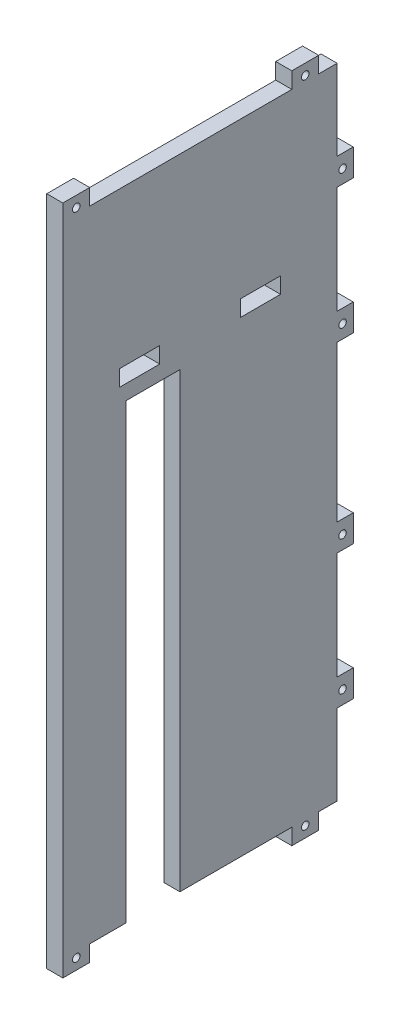
from build123d import *

# Parameters (mm, degrees)
ESQUISSE1_W             = 102.17
ESQUISSE1_H             = 238
ESQUISSE1_W_2           = 15
ESQUISSE1_H_2           = 6
BOSS_EXTRU_1_DEPTH      = 6
ESQUISSE3_W             = 10
ESQUISSE3_H             = 6
ESQUISSE3_W_2           = 6
ESQUISSE3_H_2           = 10
BOSS_EXTRU_5_DEPTH      = 6
ESQUISSE4_R             = 1.4
ENL_V_MAT_EXTRU_1_DEPTH = 6
ESQUISSE6_W             = 20
ESQUISSE6_H             = 168.46
ENL_V_MAT_EXTRU_2_DEPTH = 6


with BuildPart() as part:
    # Esquisse1 → Boss.-Extru.1 (new body)
    with BuildSketch(Plane(origin=(0, 0, 0), x_dir=(0, 0, -1), z_dir=(1, 0, 0))):
        Rectangle(ESQUISSE1_W, ESQUISSE1_H)
        with Locations((-22.5, 58)):
            Rectangle(ESQUISSE1_W_2, ESQUISSE1_H_2, mode=Mode.SUBTRACT)
        with Locations((22.5, 58)):
            Rectangle(ESQUISSE1_W_2, ESQUISSE1_H_2, mode=Mode.SUBTRACT)
    extrude(amount=BOSS_EXTRU_1_DEPTH)

    # Esquisse3 → Boss.-Extru.5 (add)
    with BuildSketch(Plane(origin=(6, 0, 0), x_dir=(0, 0, -1), z_dir=(1, 0, 0))):
        with Locations((-46.085, -122)):
            Rectangle(ESQUISSE3_W, ESQUISSE3_H)
        with Locations((39.205, -122)):
            Rectangle(ESQUISSE3_W, ESQUISSE3_H)
        with Locations((54.085, 84)):
            Rectangle(ESQUISSE3_W_2, ESQUISSE3_H_2)
        with Locations((54.085, 34)):
            Rectangle(ESQUISSE3_W_2, ESQUISSE3_H_2)
        with Locations((54.085, -34)):
            Rectangle(ESQUISSE3_W_2, ESQUISSE3_H_2)
        with Locations((54.085, -84)):
            Rectangle(ESQUISSE3_W_2, ESQUISSE3_H_2)
        with Locations((39.205, 122)):
            Rectangle(ESQUISSE3_W, ESQUISSE3_H)
        with Locations((-46.085, 122)):
            Rectangle(ESQUISSE3_W, ESQUISSE3_H)
    extrude(amount=-BOSS_EXTRU_5_DEPTH)

    # Esquisse4 → Enlèv. mat.-Extru.1 (cut)
    with BuildSketch(Plane(origin=(6, 0, 0), x_dir=(0, 0, -1), z_dir=(1, 0, 0))):
        with Locations((39.205, -121)):
            Circle(ESQUISSE4_R)
        with Locations((53.085, -84)):
            Circle(ESQUISSE4_R)
        with Locations((53.085, -34)):
            Circle(ESQUISSE4_R)
        with Locations((-46.085, 121)):
            Circle(ESQUISSE4_R)
        with Locations((53.085, 34)):
            Circle(ESQUISSE4_R)
        with Locations((53.085, 84)):
            Circle(ESQUISSE4_R)
        with Locations((39.205, 121)):
            Circle(ESQUISSE4_R)
        with Locations((-46.085, -121)):
            Circle(ESQUISSE4_R)
    extrude(amount=-ENL_V_MAT_EXTRU_1_DEPTH, mode=Mode.SUBTRACT)

    # Esquisse6 → Enlèv. mat.-Extru.2 (cut)
    with BuildSketch(Plane(origin=(6, 0, 0), x_dir=(0, 0, -1), z_dir=(1, 0, 0))):
        with Locations((-17.485, -34.77)):
            Rectangle(ESQUISSE6_W, ESQUISSE6_H)
    extrude(amount=-ENL_V_MAT_EXTRU_2_DEPTH, mode=Mode.SUBTRACT)


solid = part.part
